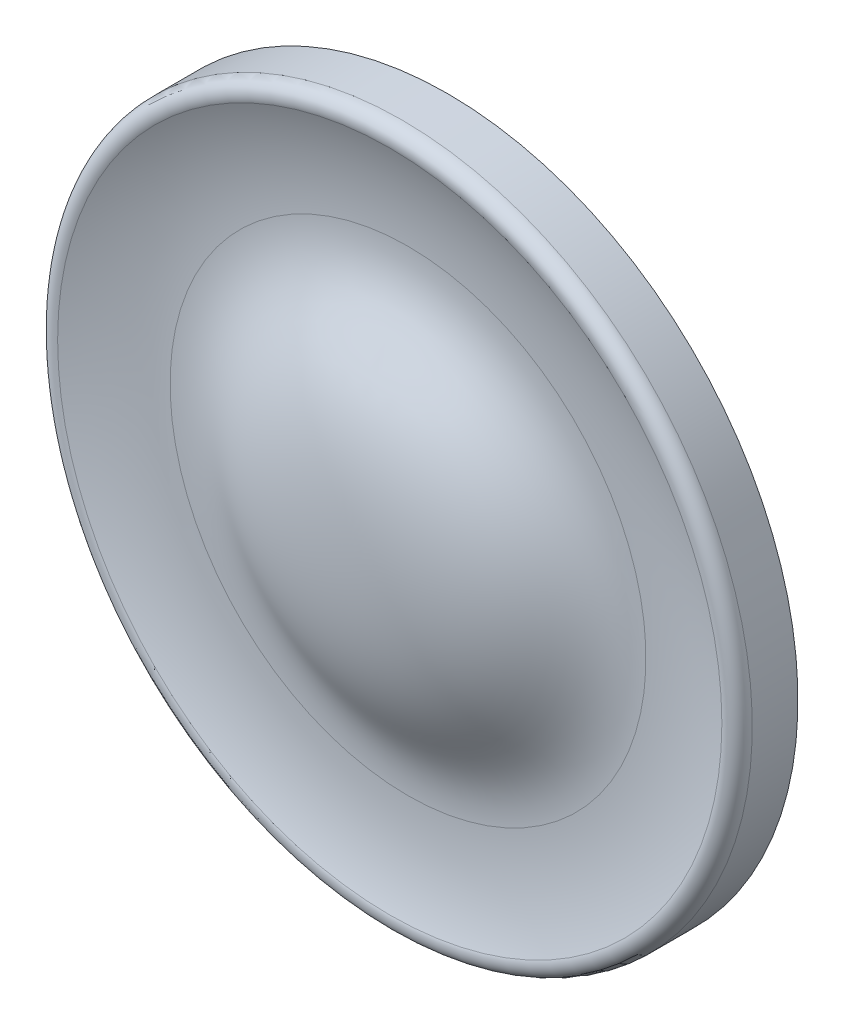
from build123d import *


# Read off the part's stored shape, not the designer's step: Révolution1
with BuildPart() as part:
    # Révolution1 outline → Révolution1 (revolve)
    with BuildSketch(Plane.XZ):
        with BuildLine():
            Line((0, 0), (13.25, 0))
            Line((13.25, 0), (13.25, 1.727300486))
            ThreePointArc((13.25, 1.727300486), (13.029769598, 2.141702431), (12.563084112, 2.191048748))
            ThreePointArc((12.563084112, 2.191048748), (10.814739428, 1.674356959), (9, 1.5))
            add(Edge.make_bspline(
                [(9, 1.5), (6, 1.5), (6, 4), (0, 4)],
                knots=[0, 0, 0, 0, 1, 1, 1, 1], degree=3))
            Line((0, 4), (0, 0))
        make_face()
    revolve(axis=Axis((0, 0, 0), (0, 0, 1)))

    # Esquisse3 → Enlèvement de matière-Révolution1 (revolve, cut)
    with BuildSketch(Plane(origin=(0, 0, 0), x_dir=(0, 0, -1), z_dir=(1, 0, 0))):
        with BuildLine():
            Line((1, 13.25), (0, 13.25))
            Line((0, 13.25), (0, 9))
            add(Edge.make_bspline(
                [(-3, 0), (-3, 6), (0, 6), (0, 9)],
                knots=[0, 0, 0, 0, 1, 1, 1, 1], degree=3))
            Line((-3, 0), (1, 0))
            Line((1, 0), (1, 13.25))
        make_face()
    revolve(axis=Axis((0, 0, 0), (0, 0, -1)), mode=Mode.SUBTRACT)


solid = part.part
